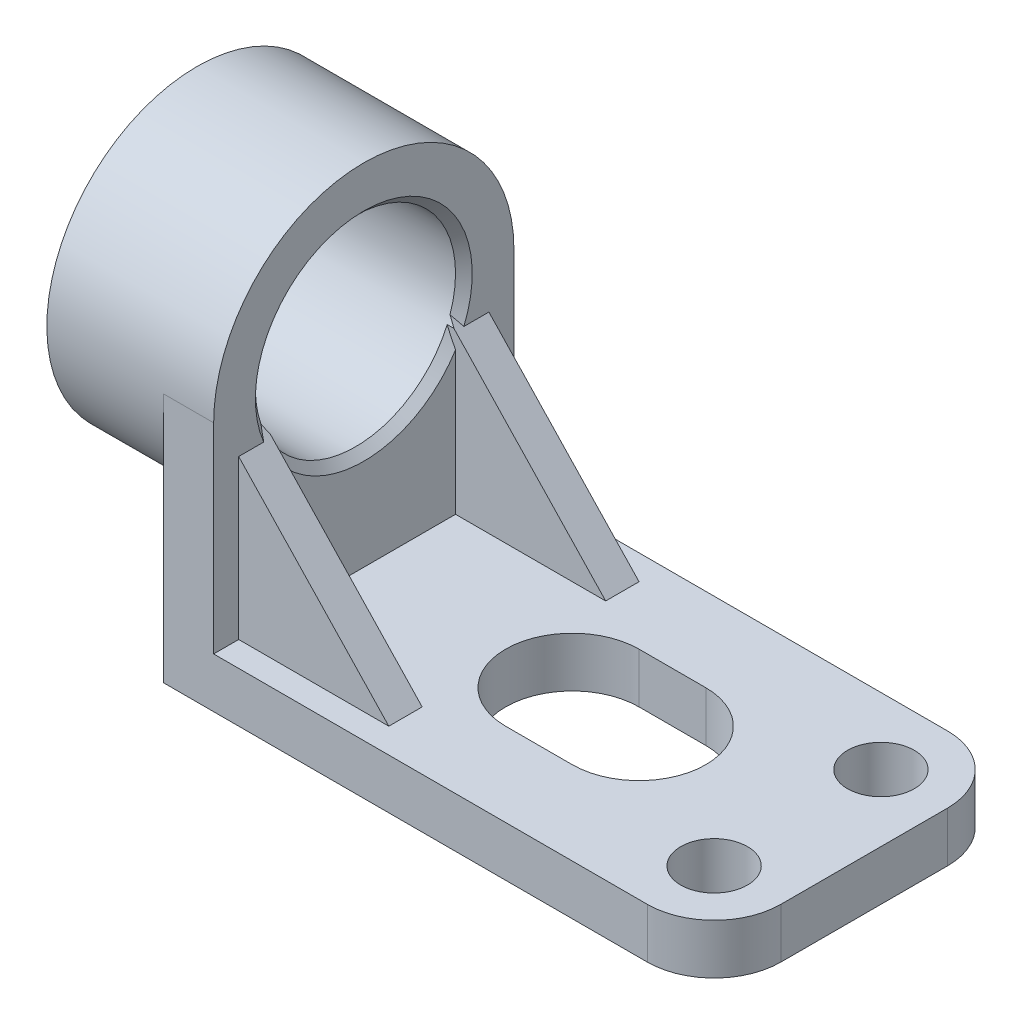
from build123d import *

# Parameters (mm, degrees)
BOSS_EXTRUDE1_DEPTH = 36
SKETCH2_R           = 18
BOSS_EXTRUDE2_DEPTH = 20
BOSS_EXTRUDE3_START = 3
BOSS_EXTRUDE3_DEPTH = 4
HOLE1_D             = 24
CHAMFER1_SIZE       = 1
CUT_EXTRUDE1_DEPTH  = 87.116200566
FILLET1_R           = 8
HOLE2_D             = 8


with BuildPart() as part:
    # Sketch1 → Boss-Extrude1 (new body)
    with BuildSketch(Plane.XY):
        Polygon((0, 30), (0, 0), (66, 0), (66, 6), (6, 6), (6, 30), align=None)
    extrude(amount=BOSS_EXTRUDE1_DEPTH)

    # Sketch2 → Boss-Extrude2 (add)
    with BuildSketch(Plane(origin=(6, 0, 0), x_dir=(0, 0, -1), z_dir=(1, 0, 0))):
        with Locations(Location((-18, 30, 0), (0, 0, 90))):
            Circle(SKETCH2_R)
    extrude(amount=-BOSS_EXTRUDE2_DEPTH)

    # Sketch3 → Boss-Extrude3 (add)
    with BuildSketch(Plane.XY.offset(BOSS_EXTRUDE3_START)):
        Polygon((6, 25), (24, 6), (6, 6), align=None)
    boss_extrude3 = extrude(amount=BOSS_EXTRUDE3_DEPTH)

    # Mirror1: Boss-Extrude3 across plane
    add(boss_extrude3.mirror(Plane.XY.offset(18)))

    # Hole1 (through all)
    with Locations(Plane.ZY.offset(14)):
        with Locations((18, 30)):
            Hole(HOLE1_D / 2)

    # Chamfer1
    # the kernel refuses this chamfer: 1 mm, written as the material it takes off along each edge
    with BuildSketch(Plane(origin=(-14, 30, 18), x_dir=(0, 0, -1), z_dir=(0, -1, 0))) as chamfer1_piece_1:
        Polygon((12, CHAMFER1_SIZE), (12 + CHAMFER1_SIZE, 0), (12, 0), align=None)
    revolve(axis=Axis((-14, 30, 18), (1, 0, 0)), mode=Mode.SUBTRACT)
    with BuildSketch(Plane(origin=(6, 30, 18), x_dir=(0, 0, -1), z_dir=(0, -1, 0))) as chamfer1_piece_2_section:
        Polygon((12 + CHAMFER1_SIZE, 0), (12, -CHAMFER1_SIZE), (12, 0), align=None)
    chamfer1_piece_2 = revolve(axis=Axis((6, 30, 18), (1, 0, 0)), mode=Mode.PRIVATE)
    chamfer1_piece_2 = split(chamfer1_piece_2, bisect_by=Plane(origin=(1.543769163, 29.703799217, 6.002209696), z_dir=(0.7259526839058266, 0.6877446479107833, 0)), keep=Keep.TOP, mode=Mode.PRIVATE)
    add(chamfer1_piece_2, mode=Mode.SUBTRACT)
    with BuildSketch(Plane(origin=(6, 30, 18), x_dir=(0, 0, -1), z_dir=(0, -1, 0))) as chamfer1_piece_3_section:
        Polygon((12 + CHAMFER1_SIZE, 0), (12, -CHAMFER1_SIZE), (12, 0), align=None)
    chamfer1_piece_3 = revolve(axis=Axis((6, 30, 18), (1, 0, 0)), mode=Mode.PRIVATE)
    chamfer1_piece_3 = split(chamfer1_piece_3, bisect_by=Plane(origin=(5.516878747, 17.516878747, 7), z_dir=(0, 0, 1)), keep=Keep.TOP, mode=Mode.PRIVATE)
    chamfer1_piece_3 = split(chamfer1_piece_3, bisect_by=Plane(origin=(5.516878747, 17.516878747, 29), z_dir=(0, 0, -1)), keep=Keep.TOP, mode=Mode.PRIVATE)
    add(chamfer1_piece_3, mode=Mode.SUBTRACT)

    # Sketch7 → Cut-Extrude1 (cut, through all)
    with BuildSketch(Plane(origin=(0, 6, 0), x_dir=(1, 0, 0), z_dir=(0, 1, 0))):
        with BuildLine():
            Line((31, -10), (39, -10))
            ThreePointArc((39, -10), (47, -18), (39, -26))
            Line((39, -26), (31, -26))
            ThreePointArc((31, -26), (23, -18), (31, -10))
        make_face()
    extrude(amount=-CUT_EXTRUDE1_DEPTH, mode=Mode.SUBTRACT)

    # Fillet1
    fillet1_edges = [part.edges().sort_by_distance(p)[0] for p in [
        (66, 3, 36),
        (66, 3, 0),
    ]]
    fillet(fillet1_edges, radius=FILLET1_R)

    # Hole2 (through all)
    with Locations(Plane(origin=(0, 6, 0), x_dir=(1, 0, 0), z_dir=(0, 1, 0))):
        with Locations((58, -8), (58, -28)):
            Hole(HOLE2_D / 2)


solid = part.part
